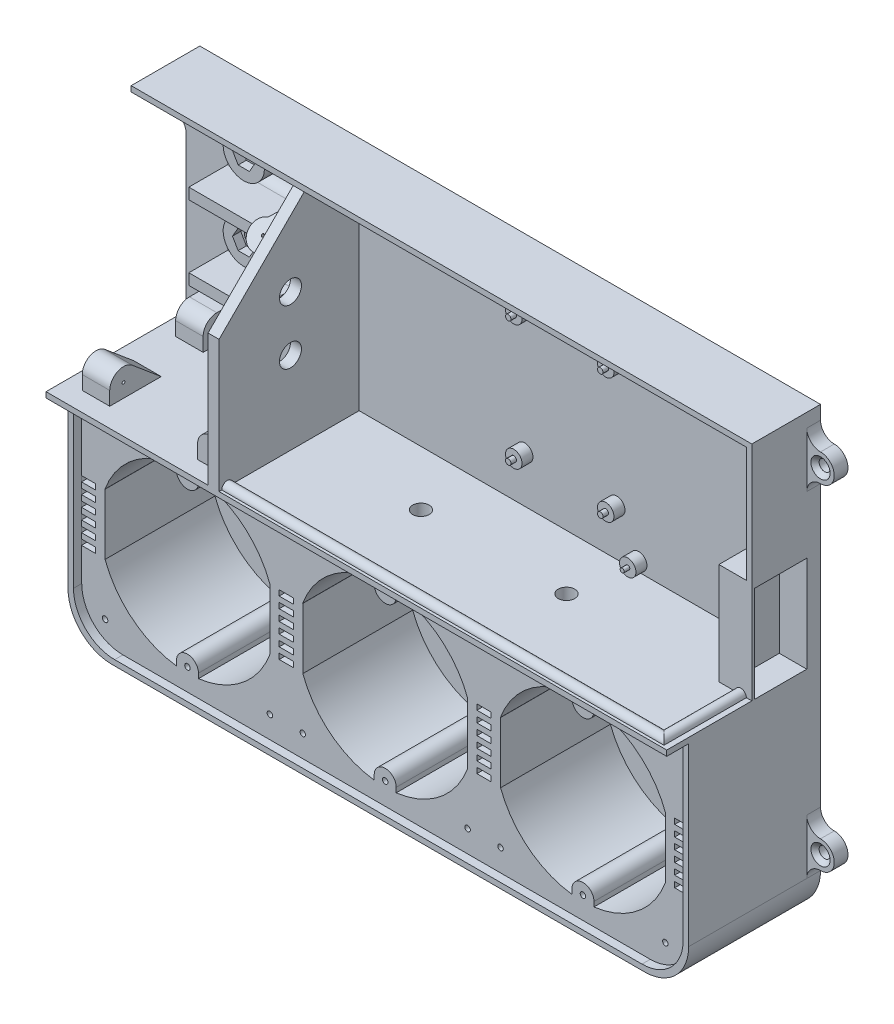
from build123d import *

# Parameters (mm, degrees)
SKETCH_1_W               = 226.00000000000003
SKETCH_1_H               = 173
EXTRUDE_1_DEPTH          = 5
EXTRUDE_2_DEPTH          = 20
EXTRUDE_3_DEPTH          = 20
SKETCH_4_R               = 0.7500000000000121
SKETCH_4_R_2             = 0.9999999999999983
EXTRUDE_4_DEPTH          = 6
SKETCH_5_R               = 3.250000000000008
SKETCH_5_R_2             = 2.9999999999999947
SKETCH_5_R_3             = 3.0000000000000218
EXTRUDE_6_DEPTH          = 4
CUT_EXTRUDE_1_DEPTH      = 4
SKETCH_8_W               = 4
SKETCH_8_H               = 83
EXTRUDE_7_DEPTH          = 20
SKETCH_11_W              = 226.00000000000003
SKETCH_11_H              = 2
EXTRUDE_8_DEPTH          = 31
EXTRUDE_9_DEPTH          = 4
EXTRUDE_13_DEPTH         = 1
EXTRUDE_14_DEPTH         = 161
EXTRUDE_START            = -6.2
SKETCH_26_R              = 0.5000000000000009
SKETCH_26_R_2            = 0.49999999999999917
EXTRUDE_16_DEPTH         = 10
SKETCH_27_R              = 0.49999999999999917
EXTRUDE_17_DEPTH         = 15
EXTRUDE_START_2          = -6.5
SKETCH_28_R              = 0.49999999999999917
EXTRUDE_18_DEPTH         = 15
CHAMFER_START            = 117.092929113
CHAMFER_1_OUTLINE_R      = 0.5
CHAMFER_1_DEPTH          = 15
CHAMFER_START_2          = 108.362883677
CHAMFER_1_2_OUTLINE_R    = 0.5
CHAMFER_1_2_DEPTH        = 8.730045436
CHAMFER_START_3          = 83.237590053
CHAMFER_1_3_DEPTH        = 18.054225812
CHAMFER_1_4_DEPTH        = 18.416407865
CHAMFER_START_4          = 54.5000001
CHAMFER_2_DEPTH          = 5.4999999
CHAMFER_START_5          = 52.76842
CHAMFER_2_2_DEPTH        = 0.731654095
CHAMFER_START_6          = 49
CHAMFER_2_3_DEPTH        = 3.76842
CHAMFER_START_7          = 53.500074095
CHAMFER_2_4_DEPTH        = 0.999926005
CHAMFER_START_8          = 24.8
CHAMFER_2_5_OUTLINE_R    = 0.5
CHAMFER_2_5_DEPTH        = 10
CUT_EXTRUDE_5_DEPTH      = 290.1470214268167
CUT_EXTRUDE_5_DEPTH_BACK = 290.1470214268167
SKETCH_29_R              = 31.999999999999993
SKETCH_29_R_2            = 31.99999999999998
SKETCH_29_R_3            = 32.00000000000001
EXTRUDE_19_DEPTH         = 40
SKETCH_31_R              = 0.9999999999999983
EXTRUDE_20_DEPTH         = 40
SKETCH_32_W              = 5.200000000000017
SKETCH_32_H              = 2
SKETCH_32_W_2            = 5.20000000000001
CUT_EXTRUDE_6_DEPTH      = 40
SKETCH_34_R              = 2.9999999999999947
SKETCH_34_R_2            = 3.0000000000000084
SKETCH_34_R_3            = 5.4070013539810935
CUT_EXTRUDE_7_DEPTH      = 45
EXTRUDE_21_DEPTH         = 3
FILLET_2_R               = 15
FILLET_3_R               = 16
EXTRUDE_22_DEPTH         = 40
SKETCH_38_R              = 4.0000000000000036
CUT_EXTRUDE_9_DEPTH      = 4
FILLET_4_R               = 10
SKETCH_39_R              = 1.9999999999999967
SKETCH_39_R_2            = 1.9999999999999982
SKETCH_39_R_3            = 1.9999999999999973
EXTRUDE_23_DEPTH         = 5
FILLET_5_R               = 5
CHAMFER_3_SIZE           = 1.5
SKETCH_40_R              = 7.500000000000011
SKETCH_40_R_2            = 7.500000000000004
SKETCH_40_R_3            = 7.500000000000001
EXTRUDE_24_DEPTH         = 10
SKETCH_41_R              = 7.500000000000011
SKETCH_41_R_2            = 2.7499999999999987
SKETCH_41_R_3            = 7.500000000000007
SKETCH_41_R_4            = 2.750000000000002
EXTRUDE_25_DEPTH         = 7
CUT_EXTRUDE_START        = 30
SKETCH_43_R              = 3.5000000000000058
CUT_EXTRUDE_10_DEPTH     = 148
SKETCH_37_R              = 1.0000000000000018
SKETCH_37_R_2            = 0.9999999999999983
CUT_EXTRUDE_13_DEPTH     = 10
EXTRUDE_26_DEPTH         = 18
FILLET_6_R               = 4


with BuildPart() as part:
    # Эскиз1 → Бобышка-Вытянуть1 (new body)
    with BuildSketch(Plane.XY):
        with Locations((113.00000000000001, 86.5)):
            Rectangle(SKETCH_1_W, SKETCH_1_H)
    extrude(amount=EXTRUDE_1_DEPTH)

    # Эскиз2 → Бобышка-Вытянуть2 (add)
    with BuildSketch(Plane.XY.offset(5)):
        Polygon((0, 92), (226, 92), (226, 90), (2.97e-15, 90), align=None)
        Polygon((0, 173), (226, 173), (226, 170.99999999999997), (1.71e-15, 170.99999999999997), align=None)
    extrude(amount=EXTRUDE_2_DEPTH)

    # Эскиз3 → Бобышка-Вытянуть3 (add)
    with BuildSketch(Plane.XY.offset(5)):
        Polygon((216, 92), (216, 127), (226, 127), (226, 173), (224, 173), (224, 129), (214, 129), (214, 90), (226, 90), (226, 92), align=None)
    extrude(amount=EXTRUDE_3_DEPTH)

    # Эскиз4 → Бобышка-Вытянуть4 (add)
    with BuildSketch(Plane.XY.offset(5)):
        with Locations(Location((212, 95.5, 0), (0, 0, 180))):
            Circle(SKETCH_4_R)
        with Locations(Location((164.8, 95.49999999999967, 0), (0, 0, 180))):
            Circle(SKETCH_4_R)
        with Locations(Location((164.79999999999976, 160.49999999999966, 0), (0, 0, 180))):
            Circle(SKETCH_4_R)
        with Locations(Location((211.99999999999977, 160.5, 0), (0, 0, 180))):
            Circle(SKETCH_4_R)
        with Locations(Location((156.79999999999998, 109, 0), (0, 0, 180))):
            Circle(SKETCH_4_R_2)
        with Locations(Location((123.29999999999997, 108.99999999999976, 0), (0, 0, 180))):
            Circle(SKETCH_4_R_2)
        with Locations(Location((123.2999999999998, 154.49999999999974, 0), (0, 0, 180))):
            Circle(SKETCH_4_R_2)
        with Locations(Location((156.7999999999998, 154.5, 0), (0, 0, 180))):
            Circle(SKETCH_4_R_2)
    extrude(amount=EXTRUDE_4_DEPTH)

    # Эскиз5 → Бобышка-Вытянуть6 (add)
    with BuildSketch(Plane.XY.offset(5)):
        with Locations((212, 95.5)):
            Circle(SKETCH_5_R)
        with Locations(Location((164.8, 95.49999999999967, 0), (0, 0, 180))):
            Circle(SKETCH_5_R_2)
        with Locations(Location((211.99999999999977, 160.5, 0), (0, 0, 180))):
            Circle(SKETCH_5_R_2)
        with Locations(Location((164.79999999999976, 160.49999999999966, 0), (0, 0, 180))):
            Circle(SKETCH_5_R_2)
        with Locations(Location((156.79999999999998, 109, 0), (0, 0, 180))):
            Circle(SKETCH_5_R_2)
        with Locations(Location((156.7999999999998, 154.5, 0), (0, 0, 180))):
            Circle(SKETCH_5_R_2)
        with Locations(Location((123.2999999999998, 154.49999999999974, 0), (0, 0, 180))):
            Circle(SKETCH_5_R_2)
        with Locations(Location((123.29999999999997, 108.99999999999976, 0), (0, 0, 180))):
            Circle(SKETCH_5_R_3)
    extrude(amount=EXTRUDE_6_DEPTH)

    # Эскиз7 → Вырез-Вытянуть1 (cut)
    with BuildSketch(Plane(origin=(216, 0, 0), x_dir=(0, 0, -1), z_dir=(1, 0, 0))):
        with BuildLine():
            Line((-15.97400000000003, 113.31602768171261), (-15.182000000000027, 113.31602768171261))
            ThreePointArc((-15.182000000000027, 113.31602768171261), (-14.715309524416908, 113.12271815729575), (-14.52200000000003, 112.65602768171263))
            Line((-14.52200000000003, 112.65602768171263), (-14.52200000000003, 106.85902768171263))
            ThreePointArc((-14.52200000000003, 106.85902768171263), (-14.715309524416908, 106.39233720612951), (-15.182000000000027, 106.19902768171264))
            Line((-15.182000000000027, 106.19902768171264), (-15.974000000000023, 106.19902768171264))
            ThreePointArc((-15.974000000000023, 106.19902768171264), (-16.171513045804915, 106.15220524559042), (-16.326989537198425, 106.0217031214257))
            Line((-16.326989537198425, 106.0217031214257), (-16.50051569420243, 105.78851452214302))
            ThreePointArc((-16.50051569420243, 105.78851452214302), (-16.733730431292702, 105.59276133589594), (-17.030000000000026, 105.52252768171263))
            Line((-17.030000000000026, 105.52252768171263), (-17.93200000000003, 105.52252768171263))
            ThreePointArc((-17.93200000000003, 105.52252768171263), (-18.398690475583148, 105.71583720612948), (-18.592000000000024, 106.1825276817126))
            Line((-18.592000000000024, 106.1825276817126), (-18.592000000000024, 113.33252768171262))
            ThreePointArc((-18.592000000000024, 113.33252768171262), (-18.39869047558317, 113.79921815729575), (-17.93200000000003, 113.99252768171264))
            Line((-17.93200000000003, 113.99252768171264), (-17.030000000000026, 113.99252768171264))
            ThreePointArc((-17.030000000000026, 113.99252768171264), (-16.733730431292702, 113.92229402752932), (-16.50051569420243, 113.72654084128226))
            Line((-16.50051569420243, 113.72654084128226), (-16.326989537198425, 113.49335224199955))
            ThreePointArc((-16.326989537198425, 113.49335224199955), (-16.171513045804915, 113.36285011783482), (-15.97400000000003, 113.31602768171261))
        make_face()
    extrude(amount=-CUT_EXTRUDE_1_DEPTH, mode=Mode.SUBTRACT)

    # Эскиз8 → Бобышка-Вытянуть7 (add)
    with BuildSketch(Plane.XY.offset(5)):
        with Locations((61.00000000000001, 131.5)):
            Rectangle(SKETCH_8_W, SKETCH_8_H)
    extrude(amount=EXTRUDE_7_DEPTH)

    # Эскиз11 → Бобышка-Вытянуть8 (add)
    with BuildSketch(Plane.XY.offset(25)):
        with Locations((113.00000000000001, 91)):
            Rectangle(SKETCH_11_W, SKETCH_11_H)
    extrude(amount=EXTRUDE_8_DEPTH)

    # Эскиз12 → Бобышка-Вытянуть9 (add)
    with BuildSketch(Plane.ZY.offset(-59)):
        Polygon((24.999999999999993, 92), (56, 92), (56, 140.00000000000034), (25, 170.99999999999997), align=None)
    extrude(amount=-EXTRUDE_9_DEPTH)

    # Эскиз16 → Бобышка-Вытянуть13 (add)
    with BuildSketch(Plane.XY.offset(25)):
        Polygon((214, 129), (225.99999999999997, 129), (226, 92), (214, 92), align=None)
    extrude(amount=-EXTRUDE_13_DEPTH)

    # По траектории1: sweep along a path in Эскиз19
    with BuildLine(Plane(origin=(0, 92, 0), x_dir=(1, 0, 0), z_dir=(0, 1, 0))) as sweep_1_path:
        Line((63, -53), (222, -53))
        Line((222, -53), (222, -25))
    # Эскиз18 → По траектории1 (sweep)
    with BuildSketch(Plane(origin=(63, 0, 0), x_dir=(0, 0, -1), z_dir=(1, 0, 0))):
        with BuildLine():
            Line((-55, 92), (-51, 92))
            ThreePointArc((-51, 92), (-53, 94), (-55, 92))
        make_face()
    sweep(path=sweep_1_path.line, transition=Transition.RIGHT)

    # Эскиз20 → Бобышка-Вытянуть14 (add)
    with BuildSketch(Plane(origin=(63, 0, 0), x_dir=(0, 0, -1), z_dir=(1, 0, 0))):
        with BuildLine():
            Line((-24, 170.99999999999997), (-20.000000000000004, 170.99999999999997))
            ThreePointArc((-20.000000000000004, 170.99999999999997), (-22.000000000000004, 168.99999999999997), (-24, 170.99999999999997))
        make_face()
    extrude(amount=EXTRUDE_14_DEPTH)

    # Эскиз26 → Бобышка-Вытянуть16 (add)
    # profile 1 of 3: a face of its own
    with BuildSketch(Plane.ZY.offset(EXTRUDE_START)):
        with BuildLine():
            Line((10, 102.00000000000001), (5, 102.00000000000001))
            Line((5, 102.00000000000001), (4.999999999999996, 92))
            Line((4.999999999999996, 92), (15.000000000000005, 92))
            Line((15.000000000000005, 92), (15.000000000000004, 97))
            ThreePointArc((15.000000000000004, 97), (13.535533905932741, 100.53553390593274), (10, 102.00000000000001))
        make_face()
        with Locations((10, 97)):
            Circle(SKETCH_26_R, mode=Mode.SUBTRACT)
    # profile 2 of 3: a face of its own
    with BuildSketch(Plane.ZY.offset(EXTRUDE_START)):
        with BuildLine():
            Line((49, 97), (49, 92))
            Line((49, 92), (30.26261290272686, 92))
            Line((30.26261290272686, 92), (40.78606195156732, 100.8302222155949))
            ThreePointArc((40.78606195156732, 100.8302222155949), (46.11309130870351, 101.53153893518324), (49, 97))
        make_face()
        with Locations((44.00000000000001, 97)):
            Circle(SKETCH_26_R_2, mode=Mode.SUBTRACT)
    # profile 3 of 3: a face of its own
    with BuildSketch(Plane.ZY.offset(EXTRUDE_START)):
        with BuildLine():
            Line((15.000000000000004, 166), (15.000000000000002, 170.99999999999997))
            Line((15.000000000000002, 170.99999999999997), (5, 171))
            Line((5, 171), (5, 161))
            Line((5, 161), (10.000000000000002, 161))
            ThreePointArc((10.000000000000002, 161), (13.535533905932741, 162.46446609406726), (15.000000000000004, 166))
        make_face()
        with Locations((10.000000000000002, 166)):
            Circle(SKETCH_26_R, mode=Mode.SUBTRACT)
    extrude(amount=-EXTRUDE_16_DEPTH)

    # Эскиз27 → Бобышка-Вытянуть17 (add)
    with BuildSketch(Plane.XY.offset(56).offset(EXTRUDE_START)):
        with BuildLine():
            Line((59, 102.00000000000001), (54, 102.00000000000001))
            ThreePointArc((54, 102.00000000000001), (50.464466094067255, 100.53553390593275), (49, 97))
            Line((49, 97), (49, 92))
            Line((49, 92), (59, 92))
            Line((59, 92), (59, 102.00000000000001))
        make_face()
        with Locations((54, 97)):
            Circle(SKETCH_27_R, mode=Mode.SUBTRACT)
    extrude(amount=-EXTRUDE_17_DEPTH)

    # Эскиз28 → Бобышка-Вытянуть18 (add)
    with BuildSketch(Plane(origin=(0, 98.00000000000104, 97.99999999999989), x_dir=(1, 0, 0), z_dir=(0, 0.7071067811865517, 0.7071067811865435)).offset(EXTRUDE_START_2)):
        with BuildLine():
            Line((54, 93.23759005323514), (59, 93.23759005323512))
            Line((59, 93.23759005323512), (59, 83.23759005323514))
            Line((59, 83.23759005323514), (54, 83.23759005323514))
            ThreePointArc((54, 83.23759005323514), (49.000000000000014, 88.23759005323512), (54, 93.23759005323514))
        make_face()
        with Locations(Location((54, 88.23759005323512, 0), (0, 0, 270))):
            Circle(SKETCH_28_R, mode=Mode.SUBTRACT)
    extrude(amount=-EXTRUDE_18_DEPTH)

    # Фаска1: read off the stored shape, not the designer's step
    # Фаска1 outline → Фаска1 (add)
    with BuildSketch(Plane(origin=(0, 0, 0), x_dir=(1, 0, 0), z_dir=(0, 0.707106781186552, 0.707106781186543)).offset(CHAMFER_START)):
        with BuildLine():
            Line((59, 101.653997918), (52.571428571, 93.029164291))
            ThreePointArc((52.571428571, 93.029164291), (49.052380816, 87.515742142), (54, 83.237590053))
            Line((54, 83.237590053), (59, 83.237590053))
            Line((59, 83.237590053), (59, 93.237590053))
            Line((59, 93.237590053), (59, 101.653997918))
        make_face()
        with Locations((54, 88.237590053)):
            Circle(CHAMFER_1_OUTLINE_R, mode=Mode.SUBTRACT)
    extrude(amount=CHAMFER_1_DEPTH)

    # Chamfer 1 2 outline → Chamfer 1 2 (add)
    with BuildSketch(Plane(origin=(0, 0, 0), x_dir=(1, 0, 0), z_dir=(0, 0.707106781186552, 0.707106781186543)).offset(CHAMFER_START_2)):
        with BuildLine():
            Line((59, 101.653997918), (52.571428571, 93.029164291))
            ThreePointArc((52.571428571, 93.029164291), (49.052380816, 87.515742142), (54, 83.237590053))
            Line((54, 83.237590053), (59, 83.237590053))
            Line((59, 83.237590053), (59, 101.653997918))
        make_face()
        with Locations((54, 88.237590053)):
            Circle(CHAMFER_1_2_OUTLINE_R, mode=Mode.SUBTRACT)
    extrude(amount=CHAMFER_1_2_DEPTH)

    # Chamfer 1 3 outline → Chamfer 1 3 (cut)
    with BuildSketch(Plane(origin=(0, 0, 0), x_dir=(1, 0, 0), z_dir=(0, 0.7071067811865429, -0.7071067811865519)).offset(CHAMFER_START_3)):
        Polygon((48, -117.092929113), (50, -117.092929113), (58.730045436, -108.362883677), (48, -108.362883677), align=None)
    extrude(amount=CHAMFER_1_3_DEPTH, mode=Mode.SUBTRACT)

    # Chamfer 1 4 outline → Chamfer 1 4 (add)
    with BuildSketch(Plane(origin=(0, 0, 0), x_dir=(1, 0, 0), z_dir=(0, 0.7071067811865429, -0.7071067811865519)).offset(CHAMFER_START_3)):
        Polygon((60, -107.092929113), (58.730045436, -108.362883677), (60, -108.362883677), align=None)
    extrude(amount=CHAMFER_1_4_DEPTH)

    # Фаска2: read off the stored shape, not the designer's step
    # Фаска2 outline → Фаска2 (add)
    with BuildSketch(Plane.YZ.offset(CHAMFER_START_4)):
        Polygon((92, 34.8), (92, 24.8), (102, 34.8), align=None)
    extrude(amount=CHAMFER_2_DEPTH)

    # Chamfer 2 2 outline → Chamfer 2 2 (add)
    with BuildSketch(Plane.YZ.offset(CHAMFER_START_5)):
        Polygon((92, 34.8), (92, 24.8), (102, 34.8), align=None)
    extrude(amount=CHAMFER_2_2_DEPTH)

    # Chamfer 2 3 outline → Chamfer 2 3 (add)
    with BuildSketch(Plane.YZ.offset(CHAMFER_START_6)):
        Polygon((92, 34.8), (92, 24.8), (102, 34.8), align=None)
    extrude(amount=CHAMFER_2_3_DEPTH)

    # Chamfer 2 4 outline → Chamfer 2 4 (add)
    with BuildSketch(Plane.YZ.offset(CHAMFER_START_7)):
        Polygon((92, 34.8), (92, 24.8), (102, 34.8), align=None)
    extrude(amount=CHAMFER_2_4_DEPTH)

    # Chamfer 2 5 outline → Chamfer 2 5 (cut)
    with BuildSketch(Plane.XY.offset(CHAMFER_START_8)):
        with Locations((54, 97)):
            Circle(CHAMFER_2_5_OUTLINE_R)
        with BuildLine():
            ThreePointArc((49, 97), (50.464466094, 100.535533906), (54, 102))
            Line((54, 102), (56, 102))
            Line((56, 102), (56, 103))
            Line((56, 103), (49, 103))
            Line((49, 103), (49, 97))
        make_face()
    extrude(amount=CHAMFER_2_5_DEPTH, mode=Mode.SUBTRACT)

    # Эскиз30 → Вырез-Вытянуть5 (cut, two sides: drawn at the far end of the back side and taken through both)
    with BuildSketch(Plane.XY.offset(5).offset(-CUT_EXTRUDE_5_DEPTH_BACK)):
        Polygon((226, 0), (0, 0), (0, 9.999999999999968), (226, 9.999999999999995), align=None)
    extrude(amount=CUT_EXTRUDE_5_DEPTH + CUT_EXTRUDE_5_DEPTH_BACK, mode=Mode.SUBTRACT)

    # Эскиз29 → Бобышка-Вытянуть19 (add)
    with BuildSketch(Plane.XY.offset(5)):
        Polygon((2.97e-15, 90), (0, 9.999999999999968), (226, 9.999999999999995), (226, 90), align=None)
        with Locations((184.5, 49.99999999999999)):
            Circle(SKETCH_29_R, mode=Mode.SUBTRACT)
        with Locations((112.5, 49.999999999999496)):
            Circle(SKETCH_29_R_2, mode=Mode.SUBTRACT)
        with Locations((40.50000000000001, 49.99999999999899)):
            Circle(SKETCH_29_R_3, mode=Mode.SUBTRACT)
    extrude(amount=EXTRUDE_19_DEPTH)

    # Эскиз31 → Бобышка-Вытянуть20 (add)
    # profile 1 of 6: a face of its own
    with BuildSketch(Plane.XY.offset(5)):
        with BuildLine():
            Line((180.5, 79.99999999999999), (180.5, 85.30125912444723))
            Line((180.5, 85.30125912444723), (188.5, 85.30125912444723))
            Line((188.5, 85.30125912444723), (188.5, 79.99999999999999))
            ThreePointArc((188.5, 79.99999999999999), (184.5, 75.99999999999999), (180.5, 79.99999999999999))
        make_face()
        with Locations((184.5, 79.99999999999999)):
            Circle(SKETCH_31_R, mode=Mode.SUBTRACT)
    # profile 2 of 6: a face of its own
    with BuildSketch(Plane.XY.offset(5)):
        with BuildLine():
            Line((180.5, 19.999999999999996), (180.5, 14.709150895953911))
            Line((180.5, 14.709150895953911), (188.5, 14.709150895953911))
            Line((188.5, 14.709150895953911), (188.5, 19.999999999999996))
            ThreePointArc((188.5, 19.999999999999996), (184.5, 23.999999999999996), (180.5, 19.999999999999996))
        make_face()
        with Locations((184.5, 19.999999999999996)):
            Circle(SKETCH_31_R, mode=Mode.SUBTRACT)
    # profile 3 of 6: a face of its own
    with BuildSketch(Plane.XY.offset(5)):
        with BuildLine():
            Line((108.5, 79.99999999999949), (108.5, 85.30125912444672))
            Line((108.5, 85.30125912444672), (116.5, 85.30125912444672))
            Line((116.5, 85.30125912444672), (116.5, 79.99999999999949))
            ThreePointArc((116.5, 79.99999999999949), (112.5, 75.99999999999949), (108.5, 79.99999999999949))
        make_face()
        with Locations((112.5, 79.99999999999949)):
            Circle(SKETCH_31_R, mode=Mode.SUBTRACT)
    # profile 4 of 6: a face of its own
    with BuildSketch(Plane.XY.offset(5)):
        with BuildLine():
            Line((108.5, 19.999999999999496), (108.5, 14.709150895953409))
            Line((108.5, 14.709150895953409), (116.5, 14.709150895953409))
            Line((116.5, 14.709150895953409), (116.5, 19.999999999999496))
            ThreePointArc((116.5, 19.999999999999496), (112.5, 23.999999999999496), (108.5, 19.999999999999496))
        make_face()
        with Locations((112.5, 19.999999999999496)):
            Circle(SKETCH_31_R, mode=Mode.SUBTRACT)
    # profile 5 of 6: a face of its own
    with BuildSketch(Plane.XY.offset(5)):
        with BuildLine():
            Line((36.50000000000001, 79.99999999999899), (36.50000000000001, 85.30125912444622))
            Line((36.50000000000001, 85.30125912444622), (44.500000000000014, 85.30125912444622))
            Line((44.500000000000014, 85.30125912444622), (44.500000000000014, 79.99999999999899))
            ThreePointArc((44.500000000000014, 79.99999999999899), (40.50000000000001, 75.99999999999899), (36.50000000000001, 79.99999999999899))
        make_face()
        with Locations((40.50000000000001, 79.99999999999899)):
            Circle(SKETCH_31_R, mode=Mode.SUBTRACT)
    # profile 6 of 6: a face of its own
    with BuildSketch(Plane.XY.offset(5)):
        with BuildLine():
            Line((36.50000000000001, 19.99999999999899), (36.50000000000001, 14.709150895952904))
            Line((36.50000000000001, 14.709150895952904), (44.500000000000014, 14.709150895952904))
            Line((44.500000000000014, 14.709150895952904), (44.500000000000014, 19.99999999999899))
            ThreePointArc((44.500000000000014, 19.99999999999899), (40.50000000000001, 23.999999999998998), (36.50000000000001, 19.99999999999899))
        make_face()
        with Locations((40.50000000000001, 19.99999999999899)):
            Circle(SKETCH_31_R, mode=Mode.SUBTRACT)
    extrude(amount=EXTRUDE_20_DEPTH)

    # Эскиз32 → Вырез-Вытянуть6 (cut)
    with BuildSketch(Plane.XY.offset(45)):
        Polygon((73.9, 56.999999999999204), (79.10000000000002, 56.99999999999921), (79.10000000000002, 54.99999999999921), (73.9, 54.999999999999204), align=None)
        Polygon((73.90000000000002, 52.999999999999204), (79.10000000000004, 52.99999999999921), (79.10000000000004, 50.99999999999921), (73.90000000000002, 50.999999999999204), align=None)
        Polygon((73.89999999999999, 60.999999999999204), (79.10000000000001, 60.999999999999204), (79.10000000000001, 58.999999999999204), (73.89999999999999, 58.9999999999992), align=None)
        Polygon((79.10000000000001, 38.99999999999922), (79.10000000000001, 40.99999999999922), (73.89999999999999, 40.999999999999226), (73.89999999999999, 38.999999999999226), align=None)
        Polygon((79.10000000000002, 42.99999999999921), (79.10000000000002, 44.99999999999921), (73.9, 44.99999999999922), (73.9, 42.99999999999922), align=None)
        with Locations((76.50000000000003, 47.99999999999922)):
            Rectangle(SKETCH_32_W, SKETCH_32_H)
        Polygon((1.9000000000000128, 56.99999999999871), (7.100000000000023, 56.999999999998714), (7.100000000000023, 54.99999999999871), (1.9000000000000128, 54.9999999999987), align=None)
        Polygon((1.9000000000000266, 52.99999999999871), (7.100000000000037, 52.999999999998714), (7.100000000000037, 50.999999999998714), (1.9000000000000266, 50.99999999999871), align=None)
        with Locations((4.500000000000004, 59.99999999999871)):
            Rectangle(SKETCH_32_W_2, SKETCH_32_H)
        Polygon((7.100000000000009, 38.999999999998714), (7.100000000000009, 40.99999999999872), (1.899999999999999, 40.99999999999873), (1.899999999999999, 38.99999999999872), align=None)
        Polygon((7.100000000000023, 42.999999999998714), (7.100000000000023, 44.999999999998714), (1.9000000000000128, 44.99999999999872), (1.9000000000000128, 42.99999999999872), align=None)
        Polygon((7.100000000000037, 46.99999999999871), (7.100000000000037, 48.999999999998714), (1.9000000000000266, 48.99999999999872), (1.9000000000000266, 46.999999999998714), align=None)
        Polygon((145.89999999999998, 56.999999999999204), (151.09999999999997, 56.99999999999921), (151.09999999999997, 54.99999999999921), (145.89999999999998, 54.999999999999204), align=None)
        Polygon((145.89999999999998, 52.999999999999204), (151.1, 52.99999999999921), (151.1, 50.99999999999921), (145.89999999999998, 50.999999999999204), align=None)
        Polygon((145.89999999999995, 60.999999999999204), (151.09999999999997, 60.999999999999204), (151.09999999999997, 58.999999999999204), (145.89999999999995, 58.9999999999992), align=None)
        Polygon((151.09999999999997, 38.99999999999922), (151.09999999999997, 40.99999999999922), (145.89999999999995, 40.999999999999226), (145.89999999999995, 38.999999999999226), align=None)
        Polygon((151.09999999999997, 42.99999999999921), (151.09999999999997, 44.99999999999921), (145.89999999999998, 44.99999999999922), (145.89999999999998, 42.99999999999922), align=None)
        with Locations((148.5, 47.99999999999922)):
            Rectangle(SKETCH_32_W, SKETCH_32_H)
        Polygon((217.89999999999992, 56.999999999999204), (223.0999999999999, 56.99999999999921), (223.0999999999999, 54.99999999999921), (217.89999999999992, 54.999999999999204), align=None)
        Polygon((217.89999999999992, 52.999999999999204), (223.09999999999994, 52.99999999999921), (223.09999999999994, 50.99999999999921), (217.89999999999992, 50.999999999999204), align=None)
        Polygon((217.8999999999999, 60.999999999999204), (223.0999999999999, 60.999999999999204), (223.0999999999999, 58.999999999999204), (217.8999999999999, 58.9999999999992), align=None)
        Polygon((223.0999999999999, 38.99999999999922), (223.0999999999999, 40.99999999999922), (217.8999999999999, 40.999999999999226), (217.8999999999999, 38.999999999999226), align=None)
        Polygon((223.0999999999999, 42.99999999999921), (223.0999999999999, 44.99999999999921), (217.89999999999992, 44.99999999999922), (217.89999999999992, 42.99999999999922), align=None)
        with Locations((220.49999999999994, 47.99999999999922)):
            Rectangle(SKETCH_32_W, SKETCH_32_H)
    extrude(amount=-CUT_EXTRUDE_6_DEPTH, mode=Mode.SUBTRACT)

    # Эскиз34 → Вырез-Вытянуть7 (cut)
    with BuildSketch(Plane(origin=(0, 92, 0), x_dir=(1, 0, 0), z_dir=(0, 1, 0))):
        with Locations(Location((158.5, -25, 0), (0, 0, 270))):
            Circle(SKETCH_34_R)
        with Locations(Location((105.5, -25, 0), (0, 0, 270))):
            Circle(SKETCH_34_R_2)
        with Locations(Location((49.90700135398111, -15.000000000000002, 0), (0, 0, 270))):
            Circle(SKETCH_34_R_3)
    extrude(amount=-CUT_EXTRUDE_7_DEPTH, mode=Mode.SUBTRACT)

    # Эскиз35 → Бобышка-Вытянуть21 (add)
    with BuildSketch(Plane.XY.offset(45)):
        Polygon((2.97e-15, 90), (0, 9.999999999999968), (226, 9.999999999999995), (226, 90), (224, 90), (224, 11.999999999999996), (2.000000000000003, 11.99999999999997), (2.000000000000003, 90), align=None)
    extrude(amount=EXTRUDE_21_DEPTH)

    # Скругление2
    fillet_2_edges = [part.edges().sort_by_distance(p)[0] for p in [
        (224, 11.999999999999996, 46.5),
        (2.000000000000003, 11.99999999999997, 46.5),
    ]]
    fillet(fillet_2_edges, radius=FILLET_2_R)

    # Скругление3
    fillet_3_edges = [part.edges().sort_by_distance(p)[0] for p in [
        (226, 9.999999999999995, 24),
        (0, 9.999999999999968, 24),
    ]]
    fillet(fillet_3_edges, radius=FILLET_3_R)

    # Эскиз36 → Бобышка-Вытянуть22 (add)
    with BuildSketch(Plane.XY.offset(5)):
        Polygon((7.100000000000009, 60.99999999999871), (10.504020953480492, 60.999999999998714), (10.504020953480492, 38.8536444951372), (7.100000000000012, 38.85364449513721), align=None)
        Polygon((70.49597904651952, 60.999999999998714), (70.49597904651952, 38.8536444951372), (73.9, 38.85364449513722), (73.89999999999999, 60.999999999998714), align=None)
        Polygon((79.1, 60.99999999999871), (82.50402095348049, 60.999999999998714), (82.50402095348049, 38.8536444951372), (79.1, 38.85364449513721), align=None)
        Polygon((142.4959790465195, 60.999999999998714), (142.4959790465195, 38.8536444951372), (145.89999999999998, 38.85364449513722), (145.89999999999998, 60.999999999998714), align=None)
        Polygon((151.09999999999997, 60.99999999999871), (154.50402095348048, 60.999999999998714), (154.50402095348048, 38.8536444951372), (151.1, 38.85364449513721), align=None)
        Polygon((214.49597904651952, 60.999999999998714), (214.49597904651952, 38.8536444951372), (217.89999999999998, 38.85364449513722), (217.89999999999995, 60.999999999998714), align=None)
    extrude(amount=EXTRUDE_22_DEPTH)

    # Эскиз38 → Вырез-Вытянуть9 (cut)
    with BuildSketch(Plane.ZY.offset(-59)):
        with Locations((30.000000000000004, 142.00000000000003)):
            Circle(SKETCH_38_R)
        with Locations((30.00000000000021, 122.00000000000001)):
            Circle(SKETCH_38_R)
    extrude(amount=-CUT_EXTRUDE_9_DEPTH, mode=Mode.SUBTRACT)

    # Скругление4
    fillet_4_edges = [part.edges().sort_by_distance(p)[0] for p in [
        (59, 119.93324317411862, 5),
    ]]
    fillet(fillet_4_edges, radius=FILLET_4_R)

    # Эскиз39 → Бобышка-Вытянуть23 (add)
    # profile 1 of 4: a face of its own
    with BuildSketch(Plane(origin=(0, 0, 0), x_dir=(-1, 0, 0), z_dir=(0, 0, -1))):
        with BuildLine():
            Line((-231, 162.99999999999997), (-226, 162.99999999999997))
            Line((-226, 162.99999999999997), (-226, 152.99999999999997))
            Line((-226, 152.99999999999997), (-231, 152.99999999999997))
            ThreePointArc((-231, 152.99999999999997), (-236, 157.99999999999997), (-231, 162.99999999999997))
        make_face()
        with Locations((-231, 157.99999999999997)):
            Circle(SKETCH_39_R, mode=Mode.SUBTRACT)
    # profile 2 of 4: a face of its own
    with BuildSketch(Plane(origin=(0, 0, 0), x_dir=(-1, 0, 0), z_dir=(0, 0, -1))):
        with BuildLine():
            Line((-226, 41.00000000000001), (-226, 31))
            Line((-226, 31), (-231, 31))
            ThreePointArc((-231, 31), (-236, 36.00000000000001), (-231, 41.00000000000001))
            Line((-231, 41.00000000000001), (-226, 41.00000000000001))
        make_face()
        with Locations(Location((-231, 36.00000000000001, 0), (0, 0, 180))):
            Circle(SKETCH_39_R, mode=Mode.SUBTRACT)
    # profile 3 of 4: a face of its own
    with BuildSketch(Plane(origin=(0, 0, 0), x_dir=(-1, 0, 0), z_dir=(0, 0, -1))):
        with BuildLine():
            Line((5.000000000000004, 30.99999999999997), (2.776e-14, 31.00000000000003))
            Line((2.776e-14, 31.00000000000003), (2.776e-14, 41.000000000000036))
            Line((2.776e-14, 41.000000000000036), (5.000000000000004, 40.99999999999998))
            ThreePointArc((5.000000000000004, 40.99999999999998), (10.000000000000089, 36.00000000000003), (5.000000000000004, 30.99999999999997))
        make_face()
        with Locations((5.000000000000032, 36.00000000000003)):
            Circle(SKETCH_39_R_2, mode=Mode.SUBTRACT)
    # profile 4 of 4: a face of its own
    with BuildSketch(Plane(origin=(0, 0, 0), x_dir=(-1, 0, 0), z_dir=(0, 0, -1))):
        with BuildLine():
            Line((2.776e-14, 152.99999999999994), (2.776e-14, 162.99999999999994))
            Line((2.776e-14, 162.99999999999994), (5.000000000000004, 163))
            ThreePointArc((5.000000000000004, 163), (10.000000000000004, 158), (5.000000000000004, 153))
            Line((5.000000000000004, 153), (2.776e-14, 152.99999999999994))
        make_face()
        with Locations(Location((5.000000000000004, 158, 0), (0, 0, 180))):
            Circle(SKETCH_39_R_3, mode=Mode.SUBTRACT)
    extrude(amount=-EXTRUDE_23_DEPTH)

    # Скругление5
    fillet_5_edges = [part.edges().sort_by_distance(p)[0] for p in [
        (226, 152.99999999999997, 2.5),
        (226, 162.99999999999997, 2.5),
        (226, 41.00000000000001, 2.5),
        (226, 31, 2.5),
        (-2.776e-14, 41.000000000000036, 2.5),
        (-2.776e-14, 31.00000000000003, 2.5),
        (-2.776e-14, 152.99999999999994, 2.5),
        (-2.776e-14, 162.99999999999994, 2.5),
    ]]
    fillet(fillet_5_edges, radius=FILLET_5_R - 0.0001)  # a hair under: the kernel refuses the full size

    # Фаска3
    chamfer_3_edges = [part.edges().sort_by_distance(p)[0] for p in [
        (233, 157.99999999999997, 5),
        (229, 36.00000000000001, 5),
        (-3.0000000000000338, 36.00000000000003, 5),
        (-7.000000000000002, 158, 5),
    ]]
    chamfer(chamfer_3_edges, length=CHAMFER_3_SIZE)

    # Эскиз40 → Бобышка-Вытянуть24 (add)
    # profile 1 of 3: a face of its own
    with BuildSketch(Plane.XY.offset(5)):
        with Locations(Location((30.999999999999996, 160.99999999999997, 0), (0, 0, 180))):
            Circle(SKETCH_40_R)
        Polygon((35.10000000000001, 160.99999999999997), (33.04999999999998, 157.44929584448377), (28.950000000000003, 157.44929584448377), (26.9, 161.00000000000003), (28.95000000000005, 164.55070415551617), (33.05, 164.5507041555162), align=None, mode=Mode.SUBTRACT)
    # profile 2 of 3: a face of its own
    with BuildSketch(Plane.XY.offset(5)):
        with Locations(Location((31.00000000000028, 133.99999999999997, 0), (0, 0, 180))):
            Circle(SKETCH_40_R_2)
        Polygon((35.10000000000029, 133.99999999999997), (33.05000000000027, 130.44929584448377), (28.950000000000273, 130.44929584448377), (26.900000000000283, 134.00000000000003), (28.950000000000333, 137.55070415551617), (33.05000000000028, 137.5507041555162), align=None, mode=Mode.SUBTRACT)
    # profile 3 of 3: a face of its own
    with BuildSketch(Plane.XY.offset(5)):
        with Locations(Location((31.00000000000056, 106.99999999999999, 0), (0, 0, 180))):
            Circle(SKETCH_40_R_3)
        Polygon((35.10000000000058, 106.99999999999999), (33.05000000000055, 103.44929584448379), (28.950000000000554, 103.44929584448379), (26.900000000000563, 107.00000000000004), (28.950000000000614, 110.55070415551619), (33.050000000000566, 110.55070415551621), align=None, mode=Mode.SUBTRACT)
    extrude(amount=EXTRUDE_24_DEPTH)

    # Эскиз41 → Бобышка-Вытянуть25 (add)
    # profile 1 of 3: a face of its own
    with BuildSketch(Plane.XY.offset(5)):
        with Locations(Location((30.999999999999996, 160.99999999999997, 0), (0, 0, 180))):
            Circle(SKETCH_41_R)
        with Locations((30.999999999999996, 160.99999999999997)):
            Circle(SKETCH_41_R_2, mode=Mode.SUBTRACT)
    # profile 2 of 3: a face of its own
    with BuildSketch(Plane.XY.offset(5)):
        with Locations(Location((31.00000000000028, 133.99999999999997, 0), (0, 0, 180))):
            Circle(SKETCH_41_R)
        with Locations((31.00000000000028, 133.99999999999997)):
            Circle(SKETCH_41_R_2, mode=Mode.SUBTRACT)
    # profile 3 of 3: a face of its own
    with BuildSketch(Plane.XY.offset(5)):
        with Locations(Location((31.00000000000056, 106.99999999999999, 0), (0, 0, 180))):
            Circle(SKETCH_41_R_3)
        with Locations((31.00000000000056, 106.99999999999999)):
            Circle(SKETCH_41_R_4, mode=Mode.SUBTRACT)
    extrude(amount=EXTRUDE_25_DEPTH)

    # Эскиз43 → Вырез-Вытянуть10 (cut)
    with BuildSketch(Plane(origin=(0, 0, 0), x_dir=(0, 0, -1), z_dir=(1, 0, 0)).offset(CUT_EXTRUDE_START)):
        with Locations(Location((-12, 71.7490157327741, 0), (0, 0, 180))):
            Circle(SKETCH_43_R)
    extrude(amount=CUT_EXTRUDE_10_DEPTH, mode=Mode.SUBTRACT)

    # Эскиз37 → Вырез-Вытянуть13 (cut)
    with BuildSketch(Plane.XY.offset(45)):
        with Locations((10.500000000000332, 79.99999999999932)):
            Circle(SKETCH_37_R)
        with Locations((70.50000000000001, 79.99999999999902)):
            Circle(SKETCH_37_R_2)
        with Locations((10.499999999999815, 19.999999999999204)):
            Circle(SKETCH_37_R)
        with Locations((70.49999999999993, 19.999999999998902)):
            Circle(SKETCH_37_R_2)
        with Locations((82.50000000000033, 79.99999999999932)):
            Circle(SKETCH_37_R_2)
        with Locations((142.50000000000003, 79.99999999999902)):
            Circle(SKETCH_37_R_2)
        with Locations((82.49999999999982, 19.999999999999204)):
            Circle(SKETCH_37_R_2)
        with Locations((142.49999999999991, 19.999999999998902)):
            Circle(SKETCH_37_R_2)
        with Locations((154.50000000000034, 79.99999999999932)):
            Circle(SKETCH_37_R_2)
        with Locations((214.50000000000003, 79.99999999999902)):
            Circle(SKETCH_37_R_2)
        with Locations((154.4999999999998, 19.999999999999204)):
            Circle(SKETCH_37_R_2)
        with Locations((214.49999999999991, 19.999999999998902)):
            Circle(SKETCH_37_R_2)
    extrude(amount=-CUT_EXTRUDE_13_DEPTH, mode=Mode.SUBTRACT)

    # Эскиз44 → Бобышка-Вытянуть26 (add)
    with BuildSketch(Plane.XY.offset(5)):
        Polygon((19.000000000000238, 149.49999999999972), (43, 149.49999999999997), (43, 145.49999999999997), (19.000000000000323, 145.49999999999972), align=None)
        Polygon((19.000000000000522, 122.49999999999972), (43.000000000000284, 122.49999999999997), (43.000000000000284, 118.49999999999997), (19.000000000000608, 118.49999999999972), align=None)
    extrude(amount=EXTRUDE_26_DEPTH)

    # Скругление6
    fillet_6_edges = [part.edges().sort_by_distance(p)[0] for p in [
        (31.00000000000012, 149.49999999999983, 5),
        (19.00000000000028, 147.49999999999972, 5),
        (31.000000000000163, 145.49999999999983, 5),
        (31.000000000000405, 122.49999999999984, 5),
        (19.000000000000565, 120.49999999999972, 5),
        (31.000000000000448, 118.49999999999984, 5),
    ]]
    fillet(fillet_6_edges, radius=FILLET_6_R - 0.0001)  # a hair under: the kernel refuses the full size


solid = part.part
